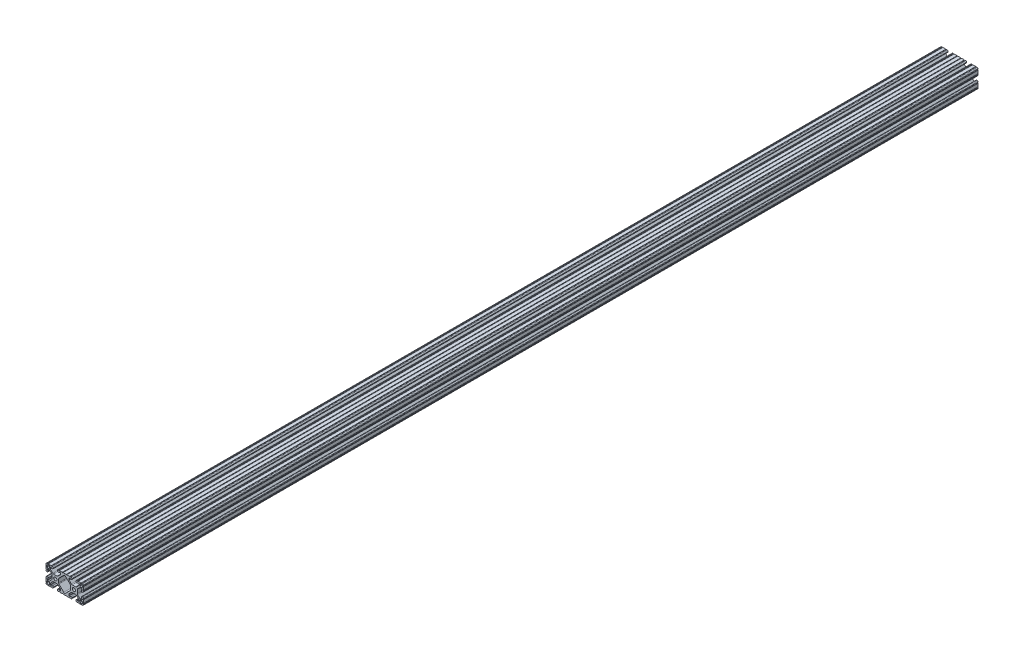
from build123d import *
from build123d.topology import SkipClean

# Parameters (mm, degrees)
BOSS_EXTRUDE1_DEPTH      = 914.4
BOSS_EXTRUDE1_DEPTH_BACK = 914.4
SKETCH3_W                = 38.1
SKETCH3_H                = 38.1
SKETCH4_W                = 5.207
SKETCH4_H                = 5.207
SKETCH4_R                = 3.3274
CUT_EXTRUDE1_DEPTH       = 1829.998426735
CUT_EXTRUDE2_DEPTH       = 1829.998426735
FILLET1_R                = 2.54
FILLET2_R                = 1.778
FILLET3_R                = 0.396875
CUT_EXTRUDE3_START       = -1828.8
CUT_EXTRUDE3_OUTLINE_R   = 0.635
CUT_EXTRUDE3_DEPTH       = 1828.8
BOSS_EXTRUDE2_DEPTH      = 1828.8
DELETEFACE1_START        = -914.4
DELETEFACE1_DEPTH        = 1828.8


# Read off the part's stored shape, not the designer's step: Cut-Extrude3, DeleteFace1
with BuildPart() as part:
    # Sketch3 → Boss-Extrude1 (new, two sides: drawn at the far end of the back side and taken through both)
    with BuildSketch(Plane.XY.offset(-BOSS_EXTRUDE1_DEPTH_BACK)):
        Rectangle(SKETCH3_W, SKETCH3_H)
    extrude(amount=BOSS_EXTRUDE1_DEPTH + BOSS_EXTRUDE1_DEPTH_BACK)

    # Sketch4 → Cut-Extrude1 (cut, through all)
    with BuildSketch(Plane.XY.offset(914.4)):
        Polygon((7.239, 14.986), (4.064, 14.986), (4.064, 19.05), (-4.064, 19.05), (-4.064, 14.986), (-7.239, 14.986), (-7.239, 16.002), (-10.287, 16.002), (-10.287, 12.442261469), (-4.601138531, 6.7564), (4.601138531, 6.7564), (10.287, 12.442261469), (10.287, 16.002), (7.239, 16.002), align=None)
        Polygon((10.287, -12.442261469), (4.601138531, -6.7564), (-4.601138531, -6.7564), (-10.287, -12.442261469), (-10.287, -16.002), (-7.239, -16.002), (-7.239, -14.986), (-4.064, -14.986), (-4.064, -19.05), (4.064, -19.05), (4.064, -14.986), (7.239, -14.986), (7.239, -16.002), (10.287, -16.002), align=None)
        Polygon((-12.442261469, -10.287), (-6.7564, -4.601138531), (-6.7564, 4.601138531), (-12.442261469, 10.287), (-16.002, 10.287), (-16.002, 7.239), (-14.986, 7.239), (-14.986, 4.064), (-19.05, 4.064), (-19.05, -4.064), (-14.986, -4.064), (-14.986, -7.239), (-16.002, -7.239), (-16.002, -10.287), align=None)
        Polygon((14.986, -7.239), (14.986, -4.064), (19.05, -4.064), (19.05, 4.064), (14.986, 4.064), (14.986, 7.239), (16.002, 7.239), (16.002, 10.287), (12.442261469, 10.287), (6.7564, 4.601138531), (6.7564, -4.601138531), (12.442261469, -10.287), (16.002, -10.287), (16.002, -7.239), align=None)
        with Locations((14.6685, 14.6685)):
            Rectangle(SKETCH4_W, SKETCH4_H)
        with Locations((14.6685, -14.6685)):
            Rectangle(SKETCH4_W, SKETCH4_H)
        with Locations((-14.6685, 14.6685)):
            Rectangle(SKETCH4_W, SKETCH4_H)
        with Locations((-14.6685, -14.6685)):
            Rectangle(SKETCH4_W, SKETCH4_H)
        Circle(SKETCH4_R)
    extrude(amount=-CUT_EXTRUDE1_DEPTH, mode=Mode.SUBTRACT)

    # Sketch5 → Cut-Extrude2 (cut, through all)
    with BuildSketch(Plane.XY.offset(914.4)):
        with BuildLine():
            Line((-14.605, 19.05), (-15.875, 19.05))
            ThreePointArc((-15.875, 19.05), (-15.24, 18.415), (-14.605, 19.05))
        make_face()
        with BuildLine():
            Line((-7.239, 19.05), (-8.509, 19.05))
            ThreePointArc((-8.509, 19.05), (-7.874, 18.415), (-7.239, 19.05))
        make_face()
        with BuildLine():
            ThreePointArc((-19.05, 14.605), (-18.415, 15.24), (-19.05, 15.875))
            Line((-19.05, 15.875), (-19.05, 14.605))
        make_face()
        with BuildLine():
            ThreePointArc((-19.05, 7.239), (-18.415, 7.874), (-19.05, 8.509))
            Line((-19.05, 8.509), (-19.05, 7.239))
        make_face()
        with BuildLine():
            ThreePointArc((7.239, 19.05), (7.874, 18.415), (8.509, 19.05))
            Line((8.509, 19.05), (7.239, 19.05))
        make_face()
        with BuildLine():
            ThreePointArc((14.605, 19.05), (15.24, 18.415), (15.875, 19.05))
            Line((15.875, 19.05), (14.605, 19.05))
        make_face()
        with BuildLine():
            Line((19.05, 14.605), (19.05, 15.875))
            ThreePointArc((19.05, 15.875), (18.415, 15.24), (19.05, 14.605))
        make_face()
        with BuildLine():
            Line((19.05, 7.239), (19.05, 8.509))
            ThreePointArc((19.05, 8.509), (18.415, 7.874), (19.05, 7.239))
        make_face()
        with BuildLine():
            ThreePointArc((19.05, -7.239), (18.415, -7.874), (19.05, -8.509))
            Line((19.05, -8.509), (19.05, -7.239))
        make_face()
        with BuildLine():
            ThreePointArc((19.05, -14.605), (18.415, -15.24), (19.05, -15.875))
            Line((19.05, -15.875), (19.05, -14.605))
        make_face()
        with BuildLine():
            Line((14.605, -19.05), (15.875, -19.05))
            ThreePointArc((15.875, -19.05), (15.24, -18.415), (14.605, -19.05))
        make_face()
        with BuildLine():
            Line((7.239, -19.05), (8.509, -19.05))
            ThreePointArc((8.509, -19.05), (7.874, -18.415), (7.239, -19.05))
        make_face()
        with BuildLine():
            ThreePointArc((-7.239, -19.05), (-7.874, -18.415), (-8.509, -19.05))
            Line((-8.509, -19.05), (-7.239, -19.05))
        make_face()
        with BuildLine():
            ThreePointArc((-14.605, -19.05), (-15.24, -18.415), (-15.875, -19.05))
            Line((-15.875, -19.05), (-14.605, -19.05))
        make_face()
        with BuildLine():
            Line((-19.05, -14.605), (-19.05, -15.875))
            ThreePointArc((-19.05, -15.875), (-18.415, -15.24), (-19.05, -14.605))
        make_face()
        with BuildLine():
            Line((-19.05, -7.239), (-19.05, -8.509))
            ThreePointArc((-19.05, -8.509), (-18.415, -7.874), (-19.05, -7.239))
        make_face()
    extrude(amount=-CUT_EXTRUDE2_DEPTH, mode=Mode.SUBTRACT)

    # Fillet1
    fillet1_edges = [part.edges().sort_by_distance(p)[0] for p in [
        (6.7564, -4.601138531, 0),
        (6.7564, 4.601138531, 0),
        (-17.272, 17.272, 0),
        (-17.272, -17.272, 0),
        (17.272, -17.272, 0),
        (17.272, 17.272, 0),
        (-4.601138531, -6.7564, 0),
        (4.601138531, -6.7564, 0),
        (-6.7564, 4.601138531, 0),
        (-6.7564, -4.601138531, 0),
        (4.601138531, 6.7564, 0),
        (-4.601138531, 6.7564, 0),
    ]]
    fillet(fillet1_edges, radius=FILLET1_R)

    # Fillet2
    fillet2_edges = [part.edges().sort_by_distance(p)[0] for p in [
        (14.986, 4.064, 0),
        (19.05, 4.064, 0),
        (19.05, -4.064, 0),
        (14.986, -4.064, 0),
        (4.064, -14.986, 0),
        (4.064, -19.05, 0),
        (-4.064, -19.05, 0),
        (-4.064, -14.986, 0),
        (-14.986, -4.064, 0),
        (-19.05, -4.064, 0),
        (-19.05, 4.064, 0),
        (-14.986, 4.064, 0),
        (-19.05, 19.05, 0),
        (19.05, 19.05, 0),
        (19.05, -19.05, 0),
        (-19.05, -19.05, 0),
        (-4.064, 14.986, 0),
        (-4.064, 19.05, 0),
        (4.064, 19.05, 0),
        (4.064, 14.986, 0),
    ]]
    fillet(fillet2_edges, radius=FILLET2_R)

    # Fillet3
    fillet3_edges = [part.edges().sort_by_distance(p)[0] for p in [
        (12.442261469, 10.287, 0),
        (16.002, 10.287, 0),
        (16.002, 7.239, 0),
        (16.002, -7.239, 0),
        (16.002, -10.287, 0),
        (12.442261469, -10.287, 0),
        (-7.239, -16.002, 0),
        (-10.287, -16.002, 0),
        (-10.287, -12.442261469, 0),
        (10.287, -12.442261469, 0),
        (10.287, -16.002, 0),
        (7.239, -16.002, 0),
        (-16.002, 7.239, 0),
        (-16.002, 10.287, 0),
        (-12.442261469, 10.287, 0),
        (-12.442261469, -10.287, 0),
        (-16.002, -10.287, 0),
        (-14.986, -7.239, 0),
        (-10.287, 12.442261469, 0),
        (-10.287, 16.002, 0),
        (-7.239, 16.002, 0),
        (7.239, 16.002, 0),
        (10.287, 16.002, 0),
        (10.287, 12.442261469, 0),
    ]]
    fillet(fillet3_edges, radius=FILLET3_R)

    # Mirror1: part across plane


with BuildPart() as part_1:
    with SkipClean():  # the faces are left unmerged after this step: merging them gives an invalid solid
        add(part.part)
        add(part.part.mirror(Plane(origin=(19.05, -19.05, 914.4), x_dir=(0, 0, 1), z_dir=(-1, 0, 0))))

    # Cut-Extrude3 outline → Cut-Extrude3 (cut)
    # profile 1 of 2: a face of its own
    with BuildSketch(Plane.XY.offset(914.4).offset(CUT_EXTRUDE3_START)):
        with BuildLine():
            Line((14.220261469, 12.065), (12.326019473, 10.170758004))
            ThreePointArc((12.326019473, 10.170758004), (12.45477499, 10.256789689), (12.606652477, 10.287))
            Line((12.606652477, 10.287), (15.605125, 10.287))
            ThreePointArc((15.605125, 10.287), (15.885758004, 10.170758004), (16.002, 9.890125))
            Line((16.002, 9.890125), (16.002, 7.635875))
            ThreePointArc((16.002, 7.635875), (15.885758004, 7.355241996), (15.605125, 7.239))
            Line((15.605125, 7.239), (14.986, 7.239))
            Line((14.986, 7.239), (14.986, 5.842))
            ThreePointArc((14.986, 5.842), (15.506764143, 4.584764143), (16.764, 4.064))
            Line((16.764, 4.064), (17.272, 4.064))
            ThreePointArc((17.272, 4.064), (18.529235857, 4.584764143), (19.05, 5.842))
            ThreePointArc((19.05, 5.842), (19.570764143, 4.584764143), (20.828, 4.064))
            Line((20.828, 4.064), (21.336, 4.064))
            ThreePointArc((21.336, 4.064), (22.593235857, 4.584764143), (23.114, 5.842))
            Line((23.114, 5.842), (23.114, 7.239))
            Line((23.114, 7.239), (22.494875, 7.239))
            ThreePointArc((22.494875, 7.239), (22.214241996, 7.355241996), (22.098, 7.635875))
            Line((22.098, 7.635875), (22.098, 9.890125))
            ThreePointArc((22.098, 9.890125), (22.214241996, 10.170758004), (22.494875, 10.287))
            Line((22.494875, 10.287), (25.493347523, 10.287))
            Line((25.493347523, 10.287), (23.715347523, 12.065))
            Line((23.715347523, 12.065), (20.828, 12.065))
            Line((20.828, 12.065), (20.828, 14.732))
            ThreePointArc((20.828, 14.732), (20.830206692, 14.837854259), (20.836822932, 14.943524591))
            Line((20.836822932, 14.943524591), (20.76385572, 15.016491803))
            ThreePointArc((20.76385572, 15.016491803), (20.172006341, 15.456843476), (19.478582008, 15.708553585))
            ThreePointArc((19.478582008, 15.708553585), (19.024177056, 14.605525276), (18.660912435, 15.741832508))
            ThreePointArc((18.660912435, 15.741832508), (17.902566976, 15.526274273), (17.246847497, 15.088569859))
            ThreePointArc((17.246847497, 15.088569859), (17.265704071, 14.910727945), (17.272, 14.732))
            Line((17.272, 14.732), (17.272, 12.065))
            Line((17.272, 12.065), (14.220261469, 12.065))
        make_face()
        with Locations((19.05, 7.874)):
            Circle(CUT_EXTRUDE3_OUTLINE_R, mode=Mode.SUBTRACT)
    # profile 2 of 2: a face of its own
    with BuildSketch(Plane.XY.offset(914.4).offset(CUT_EXTRUDE3_START)):
        with BuildLine():
            ThreePointArc((12.606652477, -10.287), (12.45477499, -10.256789689), (12.326019473, -10.170758004))
            Line((12.326019473, -10.170758004), (14.220261469, -12.065))
            Line((14.220261469, -12.065), (17.272, -12.065))
            Line((17.272, -12.065), (17.272, -14.732))
            ThreePointArc((17.272, -14.732), (17.26560989, -14.912058111), (17.246471714, -15.091210245))
            Line((17.246471714, -15.091210245), (17.253948776, -15.098687307))
            ThreePointArc((17.253948776, -15.098687307), (17.973115591, -15.603053429), (18.821073563, -15.832298646))
            ThreePointArc((18.821073563, -15.832298646), (19.05, -14.605), (19.278926437, -15.832298646))
            ThreePointArc((19.278926437, -15.832298646), (20.126884409, -15.603053429), (20.846051224, -15.098687307))
            Line((20.846051224, -15.098687307), (20.853528286, -15.091210245))
            ThreePointArc((20.853528286, -15.091210245), (20.83439011, -14.912058111), (20.828, -14.732))
            Line((20.828, -14.732), (20.828, -12.065))
            Line((20.828, -12.065), (23.879738531, -12.065))
            Line((23.879738531, -12.065), (25.773980527, -10.170758004))
            ThreePointArc((25.773980527, -10.170758004), (25.64522501, -10.256789689), (25.493347523, -10.287))
            Line((25.493347523, -10.287), (22.494875, -10.287))
            ThreePointArc((22.494875, -10.287), (22.214241996, -10.170758004), (22.098, -9.890125))
            Line((22.098, -9.890125), (22.098, -7.635875))
            ThreePointArc((22.098, -7.635875), (22.214241996, -7.355241996), (22.494875, -7.239))
            Line((22.494875, -7.239), (23.114, -7.239))
            Line((23.114, -7.239), (23.114, -5.842))
            ThreePointArc((23.114, -5.842), (22.593235857, -4.584764143), (21.336, -4.064))
            Line((21.336, -4.064), (20.828, -4.064))
            ThreePointArc((20.828, -4.064), (19.570764143, -4.584764143), (19.05, -5.842))
            ThreePointArc((19.05, -5.842), (18.529235857, -4.584764143), (17.272, -4.064))
            Line((17.272, -4.064), (16.764, -4.064))
            ThreePointArc((16.764, -4.064), (15.506764143, -4.584764143), (14.986, -5.842))
            Line((14.986, -5.842), (14.986, -7.239))
            Line((14.986, -7.239), (15.605125, -7.239))
            ThreePointArc((15.605125, -7.239), (15.885758004, -7.355241996), (16.002, -7.635875))
            Line((16.002, -7.635875), (16.002, -9.890125))
            ThreePointArc((16.002, -9.890125), (15.885758004, -10.170758004), (15.605125, -10.287))
            Line((15.605125, -10.287), (12.606652477, -10.287))
        make_face()
        with Locations((19.05, -7.874)):
            Circle(CUT_EXTRUDE3_OUTLINE_R, mode=Mode.SUBTRACT)
    extrude(amount=CUT_EXTRUDE3_DEPTH, mode=Mode.SUBTRACT)

    # Sketch7 → Boss-Extrude2 (add, through all)
    with BuildSketch(Plane.XY.offset(914.4)):
        with BuildLine():
            ThreePointArc((17.253948776, -15.098687307), (19.05, -15.842636083), (20.846051224, -15.098687307))
            Line((20.846051224, -15.098687307), (25.773980527, -10.170758004))
            Line((25.773980527, -10.170758004), (26.035, -9.909738531))
            Line((26.035, -9.909738531), (26.035, -17.272))
            Line((26.035, -17.272), (12.065, -17.272))
            Line((12.065, -17.272), (12.065, -9.909738531))
            Line((12.065, -9.909738531), (12.326019473, -10.170758004))
            Line((12.326019473, -10.170758004), (17.253948776, -15.098687307))
        make_face()
        with BuildLine():
            ThreePointArc((25.773980527, 10.170758004), (25.645225011, 10.256789689), (25.493347523, 10.287))
            Line((25.493347523, 10.287), (20.76385572, 15.016491803))
            ThreePointArc((20.76385572, 15.016491803), (18.967804496, 15.760440579), (17.171753272, 15.016491803))
            Line((17.171753272, 15.016491803), (12.326019473, 10.170758004))
            Line((12.326019473, 10.170758004), (11.900608992, 9.745347523))
            Line((11.900608992, 9.745347523), (11.900608992, 17.272))
            Line((11.900608992, 17.272), (26.035, 17.272))
            Line((26.035, 17.272), (26.035, 9.909738531))
            Line((26.035, 9.909738531), (25.773980527, 10.170758004))
        make_face()
    extrude(amount=-BOSS_EXTRUDE2_DEPTH)

    # DeleteFace1 outline → DeleteFace1 (add)
    with BuildSketch(Plane.XY.offset(DELETEFACE1_START)):
        with BuildLine():
            ThreePointArc((20.828, -19.05), (19.570764143, -18.529235857), (19.05, -17.272))
            ThreePointArc((19.05, -17.272), (18.529235857, -18.529235857), (17.272, -19.05))
            Line((17.272, -19.05), (20.828, -19.05))
        make_face()
        with BuildLine():
            Line((20.828, 19.05), (17.272, 19.05))
            ThreePointArc((17.272, 19.05), (18.529235857, 18.529235857), (19.05, 17.272))
            ThreePointArc((19.05, 17.272), (19.570764143, 18.529235857), (20.828, 19.05))
        make_face()
    extrude(amount=DELETEFACE1_DEPTH)


solid = part_1.part
